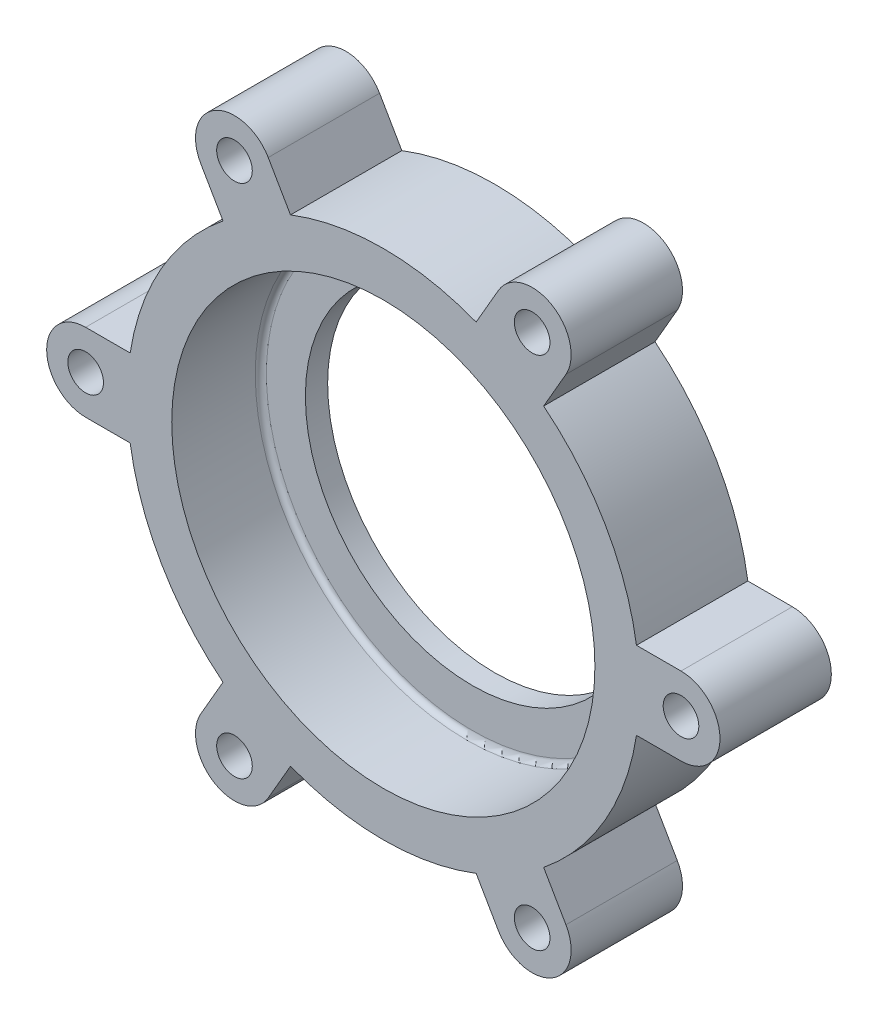
from build123d import *

# Parameters (mm, degrees)
SKETCH1_R           = 8
SKETCH1_R_2         = 95
BOSS_EXTRUDE1_DEPTH = 50
SKETCH1_3_R         = 95
SKETCH1_3_R_2       = 75
BOSS_EXTRUDE2_DEPTH = 10
FILLET1_R           = 2.5


with BuildPart() as part:
    # Sketch1 → Boss-Extrude1 (new body)
    with BuildSketch(Plane.XY):
        with BuildLine():
            Line((133.660679217, 17.5), (113.660679217, 17.5))
            ThreePointArc((113.660679217, 17.5), (99.592921435, 57.5), (71.985784175, 89.683035613))
            Line((71.985784175, 89.683035613), (81.985784175, 107.003543689))
            ThreePointArc((81.985784175, 107.003543689), (75.580339608, 130.908988255), (51.674895042, 124.503543689))
            Line((51.674895042, 124.503543689), (41.674895042, 107.183035613))
            ThreePointArc((41.674895042, 107.183035613), (0, 115), (-41.674895042, 107.183035613))
            Line((-41.674895042, 107.183035613), (-51.674895042, 124.503543689))
            ThreePointArc((-51.674895042, 124.503543689), (-75.580339608, 130.908988255), (-81.985784175, 107.003543689))
            Line((-81.985784175, 107.003543689), (-71.985784175, 89.683035613))
            ThreePointArc((-71.985784175, 89.683035613), (-99.592921435, 57.5), (-113.660679217, 17.5))
            Line((-113.660679217, 17.5), (-133.660679217, 17.5))
            ThreePointArc((-133.660679217, 17.5), (-151.160679217, 0), (-133.660679217, -17.5))
            Line((-133.660679217, -17.5), (-113.660679217, -17.5))
            ThreePointArc((-113.660679217, -17.5), (-99.592921435, -57.5), (-71.985784175, -89.683035613))
            Line((-71.985784175, -89.683035613), (-81.985784175, -107.003543689))
            ThreePointArc((-81.985784175, -107.003543689), (-75.580339608, -130.908988255), (-51.674895042, -124.503543689))
            Line((-51.674895042, -124.503543689), (-41.674895042, -107.183035613))
            ThreePointArc((-41.674895042, -107.183035613), (0, -115), (41.674895042, -107.183035613))
            Line((41.674895042, -107.183035613), (51.674895042, -124.503543689))
            ThreePointArc((51.674895042, -124.503543689), (75.580339608, -130.908988255), (81.985784175, -107.003543689))
            Line((81.985784175, -107.003543689), (71.985784175, -89.683035613))
            ThreePointArc((71.985784175, -89.683035613), (99.592921435, -57.5), (113.660679217, -17.5))
            Line((113.660679217, -17.5), (133.660679217, -17.5))
            ThreePointArc((133.660679217, -17.5), (151.160679217, 0), (133.660679217, 17.5))
        make_face()
        with Locations((133.660679217, 0)):
            Circle(SKETCH1_R, mode=Mode.SUBTRACT)
        Circle(SKETCH1_R_2, mode=Mode.SUBTRACT)
        with Locations((66.830339608, -115.753543689)):
            Circle(SKETCH1_R, mode=Mode.SUBTRACT)
        with Locations((-66.830339608, -115.753543689)):
            Circle(SKETCH1_R, mode=Mode.SUBTRACT)
        with Locations((-133.660679217, 0)):
            Circle(SKETCH1_R, mode=Mode.SUBTRACT)
        with Locations((-66.830339608, 115.753543689)):
            Circle(SKETCH1_R, mode=Mode.SUBTRACT)
        with Locations((66.830339608, 115.753543689)):
            Circle(SKETCH1_R, mode=Mode.SUBTRACT)
    extrude(amount=BOSS_EXTRUDE1_DEPTH)

    # Sketch1<3> → Boss-Extrude2 (add)
    with BuildSketch(Plane.XY):
        Circle(SKETCH1_3_R)
        Circle(SKETCH1_3_R_2, mode=Mode.SUBTRACT)
    extrude(amount=BOSS_EXTRUDE2_DEPTH)

    # Fillet1
    fillet1_edges = [part.edges().sort_by_distance(p)[0] for p in [
        (-95, 0, 10),
    ]]
    fillet(fillet1_edges, radius=FILLET1_R)


solid = part.part
